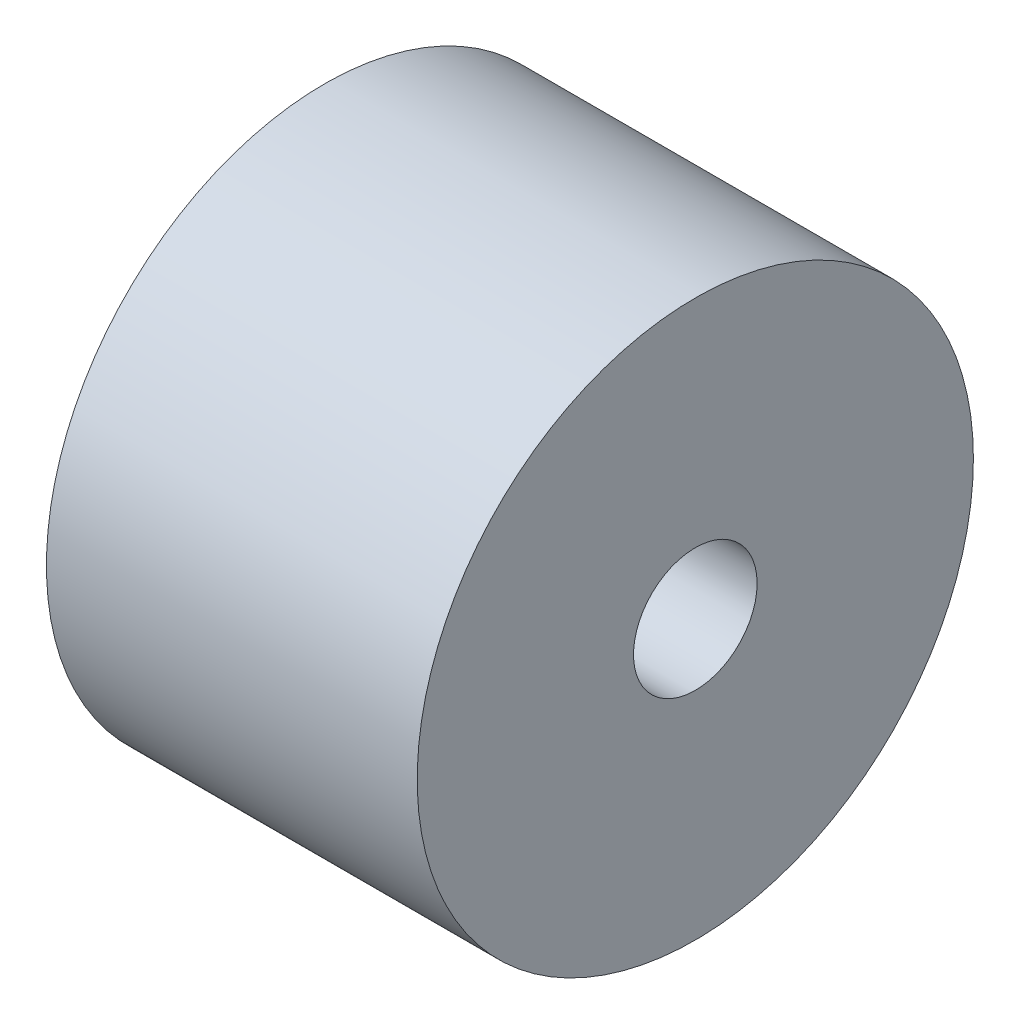
from build123d import *

# Parameters (mm, degrees)
ESBO_O1_R                = 2.25
ESBO_O1_R_2              = 0.5
RESSALTO_EXTRUS_O1_DEPTH = 3


with BuildPart() as part:
    # Esboço1 → Ressalto-extrusão1 (new body)
    with BuildSketch(Plane(origin=(0, 0, 0), x_dir=(0, 0, -1), z_dir=(1, 0, 0))):
        Circle(ESBO_O1_R)
        Circle(ESBO_O1_R_2, mode=Mode.SUBTRACT)
    extrude(amount=RESSALTO_EXTRUS_O1_DEPTH)


solid = part.part
